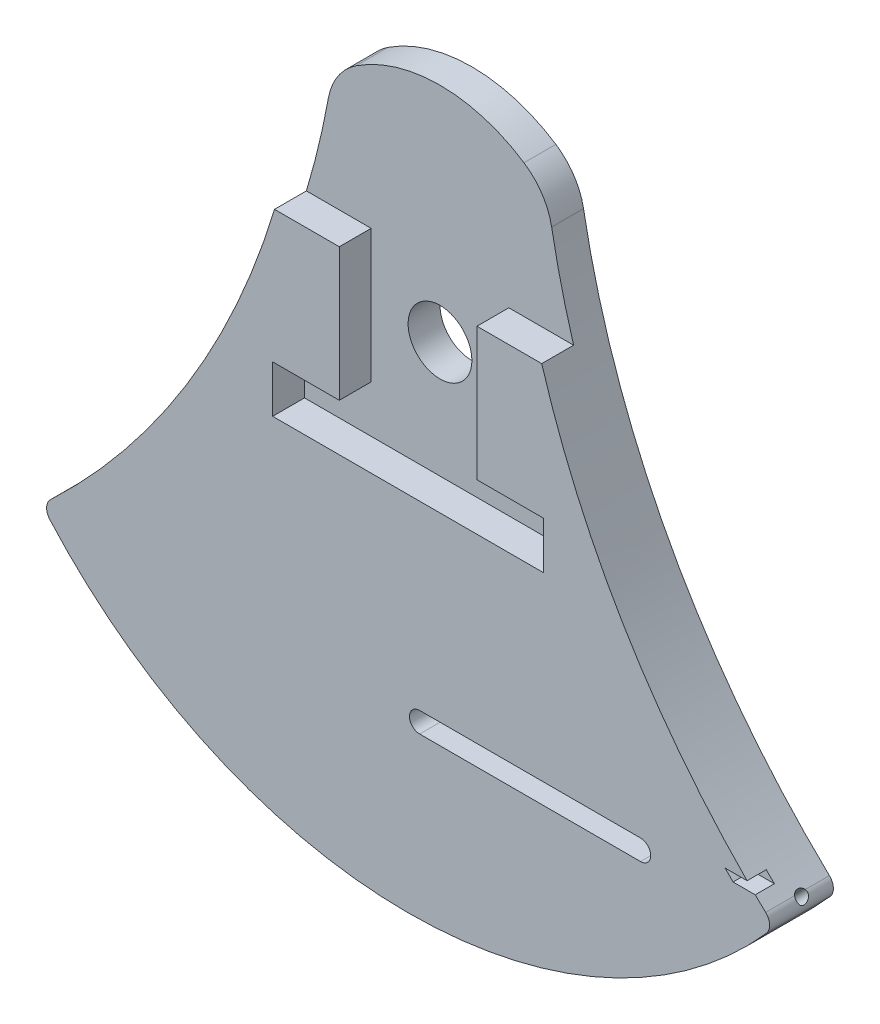
from build123d import *

# Parameters (mm, degrees)
BODY_DEPTH            = 10
SKETCH2_R             = 5
ATTACHMENT_HOLE_DEPTH = 96.00466041
WRAP1_SECTION_W       = 3
WRAP1_SECTION_H       = 6.4106076
WRAP1_ANGLE           = 84.831127775
FILLET3_R             = 2
FILLET4_R             = 2
HORIZ_SLOT_DEPTH      = 95.541676532
CUT_EXTRUDE15_DEPTH   = 3
CUT_EXTRUDE16_DEPTH   = 95.541676532
CUT_EXTRUDE17_DEPTH   = 5
FILLET5_R             = 10
SKETCH31_R            = 0.95
CUT_EXTRUDE24_DEPTH   = 95.541676532
SKETCH21_R            = 0.90381
CUT_EXTRUDE25_DEPTH   = 111.125701877
SKETCH33_R            = 1.625
CUT_EXTRUDE27_DEPTH   = 22.35


with BuildPart() as part:
    # Sketch1 → Body (new body)
    with BuildSketch(Plane.XY):
        with BuildLine():
            ThreePointArc((-57.453333234, -48.209070726), (-24.034507314, 1.033281591), (-16, 60))
            ThreePointArc((-16, 60), (0, 74.927440201), (16, 60))
            ThreePointArc((16, 60), (24.034507314, 1.033281591), (57.453333234, -48.209070726))
            ThreePointArc((57.453333234, -48.209070726), (0, -75), (-57.453333234, -48.209070726))
        make_face()
    extrude(amount=BODY_DEPTH)

    # Sketch2 → Attachment Hole (cut, through all)
    with BuildSketch(Plane.XY.offset(10)):
        Circle(SKETCH2_R)
    extrude(amount=-ATTACHMENT_HOLE_DEPTH, mode=Mode.SUBTRACT)

    # Wrap1 section (on wrap section) → Wrap1 (revolve, cut)
    with BuildSketch(Plane(origin=(0, 0, 0), x_dir=(0.7134885867247005, -0.7006668513734539, 0), z_dir=(0.7006668513734539, 0.7134885867247005, 0))):
        with Locations((73.5, -5.0694594)):
            Rectangle(WRAP1_SECTION_W, WRAP1_SECTION_H)
    revolve(axis=Axis((0, 0, 0), (0, 0, -1)), revolution_arc=WRAP1_ANGLE, mode=Mode.SUBTRACT)

    # Fillet3
    fillet3_edges = [part.edges().sort_by_distance(p)[0] for p in [
        (-57.453333234, -48.209070726, 5),
    ]]
    fillet(fillet3_edges, radius=FILLET3_R)

    # Fillet4
    fillet4_edges = [part.edges().sort_by_distance(p)[0] for p in [
        (57.453333234, -48.209070726, 5),
    ]]
    fillet(fillet4_edges, radius=FILLET4_R)

    # Sketch23 → Horiz Slot (cut, through all)
    with BuildSketch(Plane.XY.offset(10)):
        with BuildLine():
            Line((1.812113949, -46.609070726), (36.441177813, -46.609070726))
            ThreePointArc((36.441177813, -46.609070726), (38.041177813, -48.209070726), (36.441177813, -49.809070726))
            Line((36.441177813, -49.809070726), (1.812113949, -49.809070726))
            ThreePointArc((1.812113949, -49.809070726), (0.212113949, -48.209070726), (1.812113949, -46.609070726))
        make_face()
    extrude(amount=-HORIZ_SLOT_DEPTH, mode=Mode.SUBTRACT)

    # Sketch26 → Cut-Extrude15 (cut)
    with BuildSketch(Plane.XY.offset(10)):
        Polygon((54.427367135, -45.332225497), (50.951636705, -45.332225497), (49.699997105, -44.061296863), (53.150528739, -44.061296863), align=None)
    extrude(amount=-CUT_EXTRUDE15_DEPTH, mode=Mode.SUBTRACT)

    # Sketch27 → Cut-Extrude16 (cut, through all)
    with BuildSketch(Plane.XY.offset(10)):
        with BuildLine():
            ThreePointArc((-16.918727247, 27.887892651), (-15.465829132, 43.915521308), (-16, 60))
            ThreePointArc((-16, 60), (0, 74.927440201), (16, 60))
            ThreePointArc((16, 60), (15.465829132, 43.915521308), (16.918727247, 27.887892651))
            ThreePointArc((16.918727247, 27.887892651), (0, 34.895858935), (-16.918727247, 27.887892651))
        make_face()
    extrude(amount=-CUT_EXTRUDE16_DEPTH, mode=Mode.SUBTRACT)

    # Sketch17 → Cut-Extrude17 (cut)
    with BuildSketch(Plane.XY.offset(10)):
        with BuildLine():
            Line((-21.243201492, 10.060294876), (-10.792899418, 10.060294876))
            Line((-10.792899418, 10.060294876), (-10.792899418, -10.792899418))
            Line((-10.792899418, -10.792899418), (-21.241207195, -10.792899418))
            Line((-21.241207195, -10.792899418), (-21.241207195, -18.192446802))
            Line((-21.241207195, -18.192446802), (21.241207195, -18.192446802))
            Line((21.241207195, -18.192446802), (21.241207195, -10.792899418))
            Line((21.241207195, -10.792899418), (10.792899418, -10.792899418))
            Line((10.792899418, -10.792899418), (10.792899418, 10.060294876))
            Line((10.792899418, 10.060294876), (21.243201492, 10.060294876))
            ThreePointArc((21.243201492, 10.060294876), (18.825884313, 18.91221851), (16.918727247, 27.887892651))
            ThreePointArc((16.918727247, 27.887892651), (0, 34.895858935), (-16.918727247, 27.887892651))
            ThreePointArc((-16.918727247, 27.887892651), (-18.825884313, 18.91221851), (-21.243201492, 10.060294876))
        make_face()
    extrude(amount=-CUT_EXTRUDE17_DEPTH, mode=Mode.SUBTRACT)

    # Fillet5
    fillet5_edges = [part.edges().sort_by_distance(p)[0] for p in [
        (16.918727247, 27.887892651, 2.5),
        (-16.918727247, 27.887892651, 2.5),
    ]]
    fillet(fillet5_edges, radius=FILLET5_R)

    # Sketch31 → Cut-Extrude24 (cut, through all)
    with BuildSketch(Plane(origin=(0, 0, 0), x_dir=(0.7134885867247006, -0.7006668513734536, 0), z_dir=(-0.7006668513734536, -0.7134885867247006, 0))):
        with Locations((73.323950442, 4.61946028)):
            Circle(SKETCH31_R)
    extrude(amount=-CUT_EXTRUDE24_DEPTH, mode=Mode.SUBTRACT)

    # Sketch21 → Cut-Extrude25 (cut, through all)
    with BuildSketch(Plane(origin=(0, -58.989931303, 0), x_dir=(-1, 0, 0), z_dir=(0, -1, 0))):
        with Locations((53.296998856, -5.37681)):
            Circle(SKETCH21_R)
    extrude(amount=-CUT_EXTRUDE25_DEPTH, mode=Mode.SUBTRACT)

    # Sketch33 → Cut-Extrude27 (cut)
    with BuildSketch(Plane(origin=(0, -28.585713625, 0), x_dir=(-1, 0, 0), z_dir=(0, -1, 0))):
        with Locations((53.296998856, -5.376810807)):
            Circle(SKETCH33_R)
    extrude(amount=CUT_EXTRUDE27_DEPTH, mode=Mode.SUBTRACT)


solid = part.part
